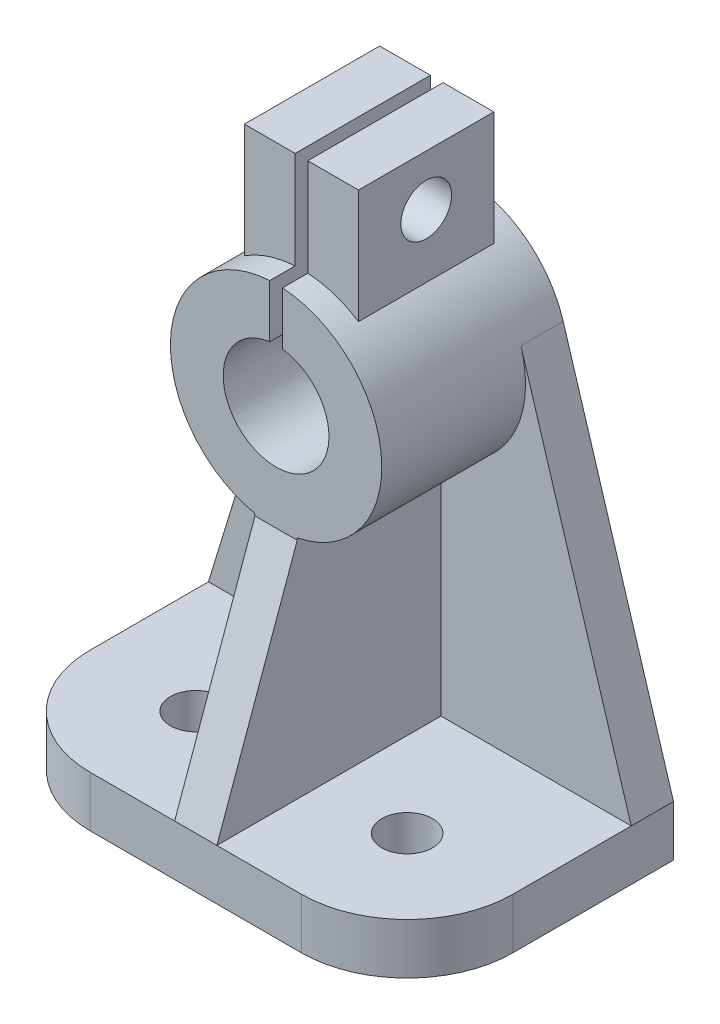
from build123d import *

# Parameters (mm, degrees)
SKETCH1_W                = 100
SKETCH1_H                = 63
BOSS_EXTRUDE1_DEPTH      = 12
FILLET1_R                = 25
SKETCH2_R                = 6
CUT_EXTRUDE1_DEPTH       = 61.301326685
BOSS_EXTRUDE2_DEPTH      = 10
SKETCH4_4_R              = 25
BOSS_EXTRUDE3_DEPTH      = 44
SKETCH5_R                = 12.5
CUT_EXTRUDE2_DEPTH       = 133.894695154
BOSS_EXTRUDE4_REACH      = 152.121
BOSS_EXTRUDE4_END_RADIUS = 25
SKETCH6_W                = 27
SKETCH6_H                = 32
SKETCH7_W                = 3
SKETCH7_H                = 62.079794859
CUT_EXTRUDE3_DEPTH       = 44
SKETCH8_R                = 6
CUT_EXTRUDE4_DEPTH       = 156.140259121
BOSS_EXTRUDE6_DEPTH      = 5
BOSS_EXTRUDE7_REACH      = 95.922
BOSS_EXTRUDE7_END_RADIUS = 25
SKETCH10_W               = 10
SKETCH10_H               = 34


with BuildPart() as part:
    # Sketch1 → Boss-Extrude1 (new body)
    with BuildSketch(Plane(origin=(0, 0, 0), x_dir=(1, 0, 0), z_dir=(0, 1, 0))):
        Rectangle(SKETCH1_W, SKETCH1_H)
    extrude(amount=BOSS_EXTRUDE1_DEPTH)

    # Fillet1
    fillet1_edges = [part.edges().sort_by_distance(p)[0] for p in [
        (50, 6, 31.5),
        (-50, 6, 31.5),
    ]]
    fillet(fillet1_edges, radius=FILLET1_R)

    # Sketch2 → Cut-Extrude1 (cut, through all)
    with BuildSketch(Plane(origin=(0, 12, 0), x_dir=(1, 0, 0), z_dir=(0, 1, 0))):
        with Locations((-25, -6.5)):
            Circle(SKETCH2_R)
        with Locations((25, -6.5)):
            Circle(SKETCH2_R)
    extrude(amount=-CUT_EXTRUDE1_DEPTH, mode=Mode.SUBTRACT)

    # Sketch4 → Boss-Extrude2 (add)
    with BuildSketch(Plane(origin=(0, 0, -31.5), x_dir=(-1, 0, 0), z_dir=(0, 0, -1))):
        with BuildLine():
            Line((-50, 12), (50, 12))
            Line((50, 12), (23.906779363, 97.312038053))
            ThreePointArc((23.906779363, 97.312038053), (0, 115), (-23.906779363, 97.312038053))
            Line((-23.906779363, 97.312038053), (-50, 12))
        make_face()
    extrude(amount=-BOSS_EXTRUDE2_DEPTH)

    # Sketch4<4> → Boss-Extrude3 (add)
    with BuildSketch(Plane(origin=(0, 0, -31.5), x_dir=(-1, 0, 0), z_dir=(0, 0, -1))):
        with Locations((0, 90)):
            Circle(SKETCH4_4_R)
    extrude(amount=-BOSS_EXTRUDE3_DEPTH)

    # Sketch5 → Cut-Extrude2 (cut, through all)
    with BuildSketch(Plane.XY.offset(12.5)):
        with Locations((0, 90)):
            Circle(SKETCH5_R)
    extrude(amount=-CUT_EXTRUDE2_DEPTH, mode=Mode.SUBTRACT)

    # Boss-Extrude4: up to this cylinder (the profile starts outside it)
    boss_extrude4_end = Plane(origin=(0, 90, -9.5), z_dir=(0, 0, -1)) * Cylinder(BOSS_EXTRUDE4_END_RADIUS, 355.242, mode=Mode.PRIVATE)
    # Sketch6 → Boss-Extrude4 (add, up to the surface)
    with BuildSketch(Plane(origin=(0, 138, 0), x_dir=(1, 0, 0), z_dir=(0, 1, 0)), mode=Mode.PRIVATE) as boss_extrude4_sk1:
        with Locations((0, 9.5)):
            Rectangle(SKETCH6_W, SKETCH6_H)
    boss_extrude4_tool1 = extrude(boss_extrude4_sk1.sketch, amount=-BOSS_EXTRUDE4_REACH, mode=Mode.PRIVATE) - boss_extrude4_end
    add(boss_extrude4_tool1.solids().sort_by_distance((0, 138, -9.5))[0])

    # Sketch7 → Cut-Extrude3 (cut)
    with BuildSketch(Plane.XY.offset(12.5)):
        with Locations((0, 127.417784488)):
            Rectangle(SKETCH7_W, SKETCH7_H)
    extrude(amount=-CUT_EXTRUDE3_DEPTH, mode=Mode.SUBTRACT)

    # Sketch8 → Cut-Extrude4 (cut, through all)
    with BuildSketch(Plane.ZY.offset(13.5)):
        with Locations((-9.5, 126)):
            Circle(SKETCH8_R)
    extrude(amount=-CUT_EXTRUDE4_DEPTH, mode=Mode.SUBTRACT)



with BuildPart() as body_2:
    # Sketch9 → Boss-Extrude6 (new, symmetric)
    with BuildSketch(Plane(origin=(0, 0, 0), x_dir=(0, 0, -1), z_dir=(1, 0, 0))):
        Polygon((-31.5, 12), (21.5, 12), (21.5, 65), (-12.5, 65), align=None)
    extrude(amount=BOSS_EXTRUDE6_DEPTH, both=True)


with BuildPart() as part_1:
    add(part.part)

    add(body_2.part)  # Boss-Extrude7 merges body 2
    # Boss-Extrude7: up to this cylinder (the profile starts outside it)
    boss_extrude7_end = Plane(origin=(0, 90, -4.5), z_dir=(0, 0, -1)) * Cylinder(BOSS_EXTRUDE7_END_RADIUS, 242.844, mode=Mode.PRIVATE)
    # Sketch10 → Boss-Extrude7 (add, up to the surface)
    with BuildSketch(Plane(origin=(0, 65, 0), x_dir=(1, 0, 0), z_dir=(0, 1, 0)), mode=Mode.PRIVATE) as boss_extrude7_sk1:
        with Locations((0, 4.5)):
            Rectangle(SKETCH10_W, SKETCH10_H)
    boss_extrude7_tool1 = extrude(boss_extrude7_sk1.sketch, amount=BOSS_EXTRUDE7_REACH, mode=Mode.PRIVATE) - boss_extrude7_end
    add(boss_extrude7_tool1.solids().sort_by_distance((0, 65, -4.5))[0])
    add(boss_extrude7_tool1.solids().sort_by_distance((0, 65, -4.5))[1])


solid = part_1.part
